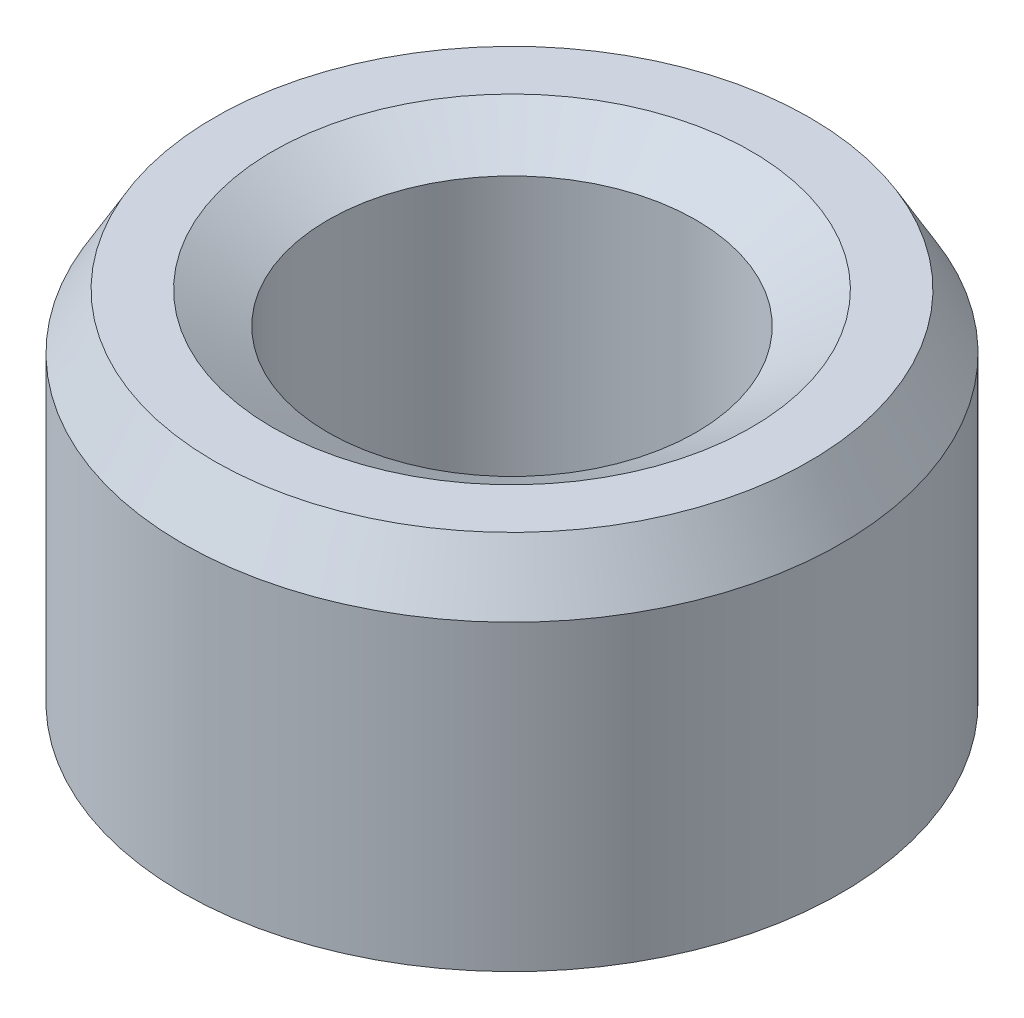
from build123d import *
from OCP.BRepFilletAPI import BRepFilletAPI_MakeChamfer

# Parameters (mm, degrees)
SKETCH1_R           = 17.5
BOSS_EXTRUDE1_DEPTH = 20.694876883
SKETCH2_R           = 9.773816529
CUT_EXTRUDE1_DEPTH  = 33.261090019
CHAMFER1_SIZE       = 2.93384283
CHAMFER1_SIZE2      = 1.693854948


with BuildPart() as part:
    # Sketch1 → Boss-Extrude1 (new body)
    with BuildSketch(Plane(origin=(0, 0, 0), x_dir=(1, 0, 0), z_dir=(0, 1, 0))):
        Circle(SKETCH1_R)
    extrude(amount=BOSS_EXTRUDE1_DEPTH)

    # Sketch2 → Cut-Extrude1 (cut, through all)
    with BuildSketch(Plane(origin=(0, 0, 0), x_dir=(1, 0, 0), z_dir=(0, 1, 0))):
        Circle(SKETCH2_R)
    extrude(amount=CUT_EXTRUDE1_DEPTH, mode=Mode.SUBTRACT)

    # Chamfer1: one chamfer whose edges measure the first distance from different faces: ONE call of the kernel's chamfer builder (chamfer() names one face for all edges)
    chamfer1_edges_1 = [part.edges().sort_by_distance(p)[0] for p in [
        (-9.773816529, 20.694876883, 0),
    ]]
    chamfer1_side_1 = [part.faces().sort_by_distance(p)[0] for p in [
        (-17.005025253, 20.694876883, 0),
    ]]
    chamfer1_edges_2 = [part.edges().sort_by_distance(p)[0] for p in [
        (-9.773816529, 0, 0),
    ]]
    chamfer1_side_2 = [part.faces().sort_by_distance(p)[0] for p in [
        (-9.773816529, 10.347438441, 0),
    ]]
    chamfer1_edges_3 = [part.edges().sort_by_distance(p)[0] for p in [
        (-17.5, 0, 0),
    ]]
    chamfer1_side_3 = [part.faces().sort_by_distance(p)[0] for p in [
        (-17.005025253, 0, 0),
    ]]
    chamfer1_edges_4 = [part.edges().sort_by_distance(p)[0] for p in [
        (-17.5, 20.694876883, 0),
    ]]
    chamfer1_side_4 = [part.faces().sort_by_distance(p)[0] for p in [
        (-17.5, 10.347438441, 0),
    ]]
    chamfer1 = BRepFilletAPI_MakeChamfer(part.part.solid().wrapped)
    for e in chamfer1_edges_1:
        chamfer1.Add(CHAMFER1_SIZE, CHAMFER1_SIZE2, e.wrapped, chamfer1_side_1[0].wrapped)  # the first distance lies on this face
    for e in chamfer1_edges_2:
        chamfer1.Add(CHAMFER1_SIZE, CHAMFER1_SIZE2, e.wrapped, chamfer1_side_2[0].wrapped)  # the first distance lies on this face
    for e in chamfer1_edges_3:
        chamfer1.Add(CHAMFER1_SIZE, CHAMFER1_SIZE2, e.wrapped, chamfer1_side_3[0].wrapped)  # the first distance lies on this face
    for e in chamfer1_edges_4:
        chamfer1.Add(CHAMFER1_SIZE, CHAMFER1_SIZE2, e.wrapped, chamfer1_side_4[0].wrapped)  # the first distance lies on this face
    add(Compound.cast(chamfer1.Shape()), mode=Mode.REPLACE)


solid = part.part
